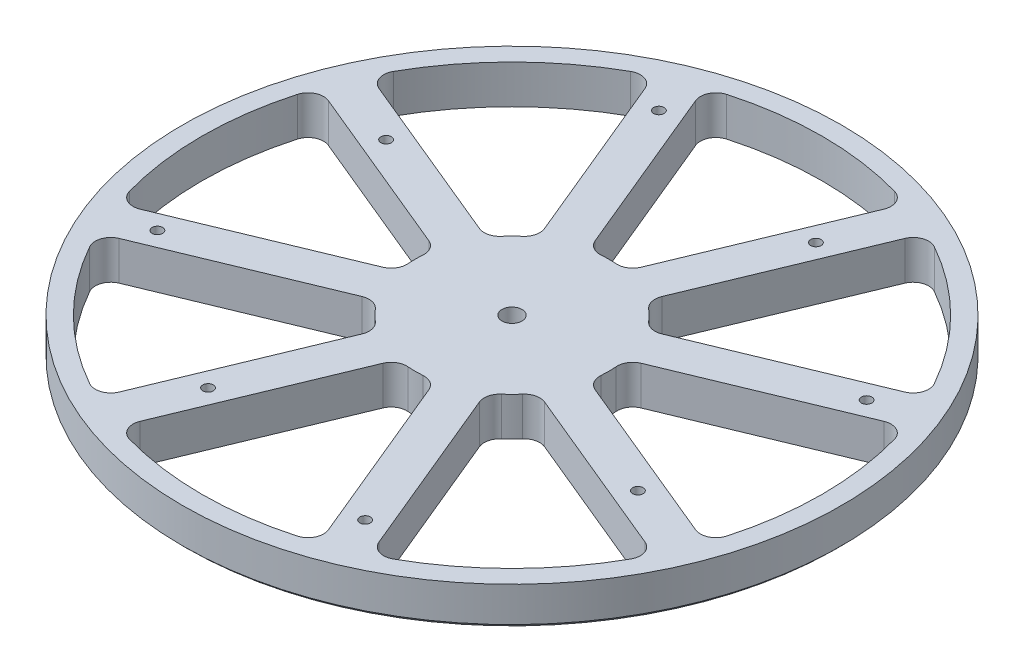
from build123d import *

# Parameters (mm, degrees)
SKETCH2_W                  = 84.99983
SKETCH2_H                  = 10
F_6_32_TAPPED_HOLE1_D      = 2.7051
CIRPATTERN3_COUNT          = 4
CUT_EXTRUDE1_DEPTH         = 121.623141229
FILLET1_R                  = 4
CIRPATTERN4_COUNT          = 8
FILLET1_OF_CIRPATTERN4_R   = 4
CHAMFER2_SIZE              = 1
F_6_0_204_DIAMETER_HOLE2_D = 5.1816


with BuildPart() as part:
    # Sketch2 → Revolve1 (revolve)
    with BuildSketch(Plane(origin=(0, 0, 0), x_dir=(0, 0, -1), z_dir=(1, 0, 0))):
        with Locations((-42.499915, 5)):
            Rectangle(SKETCH2_W, SKETCH2_H)
    revolve(axis=Axis((0, -0.5, 0), (0, 1, 0)))

    # #6-32 Tapped Hole1 (through all)
    with Locations(Plane(origin=(0, 10, 0), x_dir=(1, 0, 0), z_dir=(0, 1, 0))):
        with Locations((-26.787840266, 64.671567276), (-55.432771951, 22.961005942)):
            f_6_32_tapped_hole1 = Hole(F_6_32_TAPPED_HOLE1_D / 2)

    # CirPattern3: #6-32 Tapped Hole1 ×4 about axis
    cirpattern3_axis = Axis((0, -0.5, 0), (0, 1, 0))
    for i in range(1, CIRPATTERN3_COUNT):
        add(f_6_32_tapped_hole1.rotate(cirpattern3_axis, i * 360 / CIRPATTERN3_COUNT), mode=Mode.SUBTRACT)

    # Sketch8 → Cut-Extrude1 (cut, through all)
    with BuildSketch(Plane(origin=(0, 10, 0), x_dir=(1, 0, 0), z_dir=(0, 1, 0))):
        with BuildLine():
            Line((-4.754393761, 24.543751546), (-25.93535895, 75.67912497))
            ThreePointArc((-25.93535895, 75.67912497), (0, 79.99983), (25.93535895, 75.67912497))
            Line((25.93535895, 75.67912497), (4.754393761, 24.543751546))
            ThreePointArc((4.754393761, 24.543751546), (0, 25), (-4.754393761, 24.543751546))
        make_face()
    cut_extrude1 = extrude(amount=-CUT_EXTRUDE1_DEPTH, mode=Mode.SUBTRACT)

    # Fillet1
    fillet1_edges = [part.edges().sort_by_distance(p)[0] for p in [
        (4.754393761, 5, -24.543751546),
        (25.93535895, 5, -75.67912497),
        (-4.754393761, 5, -24.543751546),
        (-25.93535895, 5, -75.67912497),
    ]]
    fillet(fillet1_edges, radius=FILLET1_R)

    # CirPattern4: Cut-Extrude1 ×8 about axis
    cirpattern4_axis = Axis((0, -0.5, 0), (0, 1, 0))
    for i in range(1, CIRPATTERN4_COUNT):
        add(cut_extrude1.rotate(cirpattern4_axis, i * 360 / CIRPATTERN4_COUNT), mode=Mode.SUBTRACT)

    # Fillet1 of CirPattern4
    fillet1_of_cirpattern4_edges = [part.edges().sort_by_distance(p)[0] for p in [
        (-13.993189086, 5, -20.716917223),
        (-35.174154275, 5, -71.852290646),
        (-20.716917223, 5, -13.993189086),
        (-71.852290646, 5, -35.174154275),
        (-24.543751546, 5, -4.754393761),
        (-75.67912497, 5, -25.93535895),
        (-24.543751546, 5, 4.754393761),
        (-75.67912497, 5, 25.93535895),
        (-20.716917223, 5, 13.993189086),
        (-71.852290646, 5, 35.174154275),
        (-13.993189086, 5, 20.716917223),
        (-35.174154275, 5, 71.852290646),
        (-4.754393761, 5, 24.543751546),
        (-25.93535895, 5, 75.67912497),
        (4.754393761, 5, 24.543751546),
        (25.93535895, 5, 75.67912497),
        (13.993189086, 5, 20.716917223),
        (35.174154275, 5, 71.852290646),
        (20.716917223, 5, 13.993189086),
        (71.852290646, 5, 35.174154275),
        (24.543751546, 5, 4.754393761),
        (75.67912497, 5, 25.93535895),
        (24.543751546, 5, -4.754393761),
        (75.67912497, 5, -25.93535895),
        (20.716917223, 5, -13.993189086),
        (71.852290646, 5, -35.174154275),
        (13.993189086, 5, -20.716917223),
        (35.174154275, 5, -71.852290646),
    ]]
    fillet(fillet1_of_cirpattern4_edges, radius=FILLET1_OF_CIRPATTERN4_R)

    # Chamfer2
    chamfer2_edges = [part.edges().sort_by_distance(p)[0] for p in [
        (0, 0, -84.99983),
    ]]
    chamfer(chamfer2_edges, length=CHAMFER2_SIZE)

    # #6 (0.204) Diameter Hole2 (through all)
    with Locations(Plane(origin=(0, 0, 0), x_dir=(-1, 0, 0), z_dir=(0, -1, 0))):
        with Locations((0, 0)):
            Hole(F_6_0_204_DIAMETER_HOLE2_D / 2)


solid = part.part
